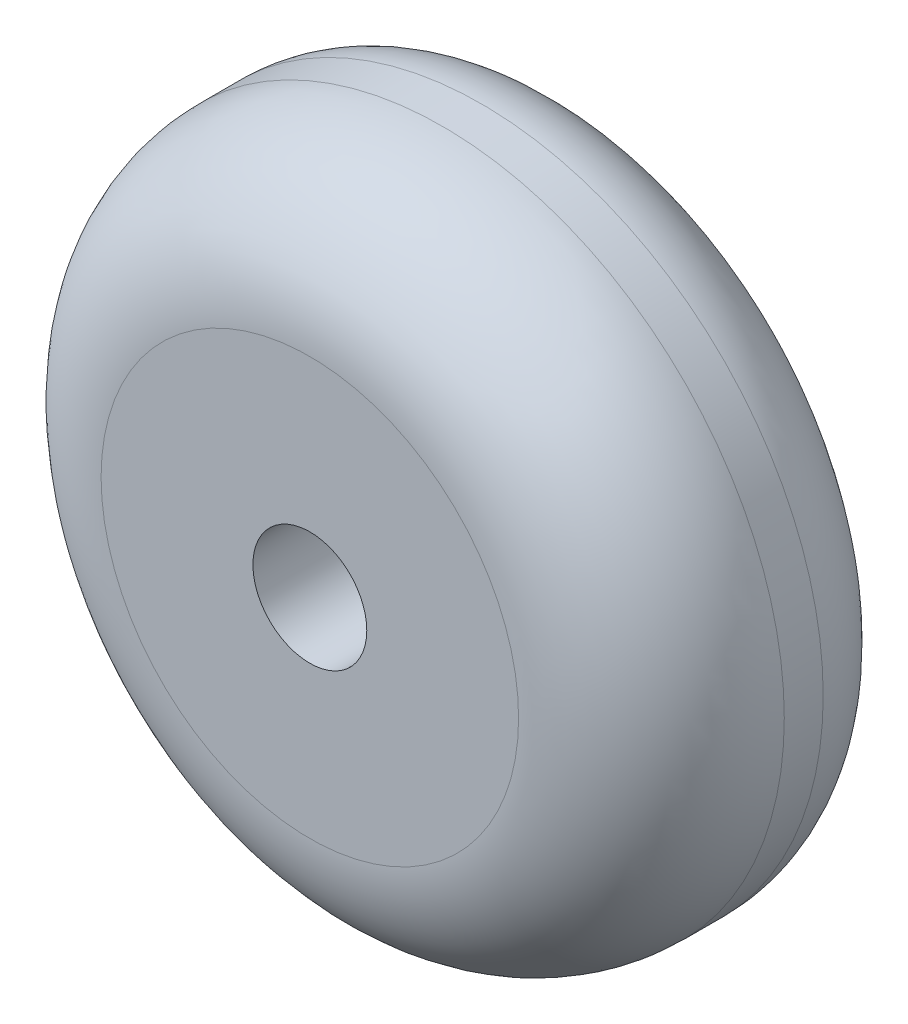
from build123d import *

# Parameters (mm, degrees)
ESBO_O1_R                = 18
RESSALTO_EXTRUS_O2_DEPTH = 14
FILETE6_R                = 7
ESBO_O3_R                = 3
CORTE_EXTRUS_O1_DEPTH    = 14


with BuildPart() as part:
    # Esboço1 → Ressalto-extrusão2 (new body)
    with BuildSketch(Plane.XY):
        Circle(ESBO_O1_R)
    extrude(amount=RESSALTO_EXTRUS_O2_DEPTH)

    # Filete6
    filete6_edges = [part.edges().sort_by_distance(p)[0] for p in [
        (-18, 0, 14),
    ]]
    fillet(filete6_edges, radius=FILETE6_R)

    # Filete7: read off the stored shape, not the designer's step
    # Filete7 outline → Filete7 (revolve, cut)
    with BuildSketch(Plane.XZ):
        with BuildLine():
            ThreePointArc((18, 4.949747468), (16.550252532, 1.449747468), (13.050252532, 0))
            Line((13.050252532, 0), (18, 0))
            Line((18, 0), (18, 4.949747468))
        make_face()
    revolve(axis=Axis((0, 0, 0), (0, 0, 1)), mode=Mode.SUBTRACT)

    # Esboço3 → Corte-extrusão1 (cut)
    with BuildSketch(Plane.XY.offset(14)):
        Circle(ESBO_O3_R)
    extrude(amount=-CORTE_EXTRUS_O1_DEPTH, mode=Mode.SUBTRACT)


solid = part.part
